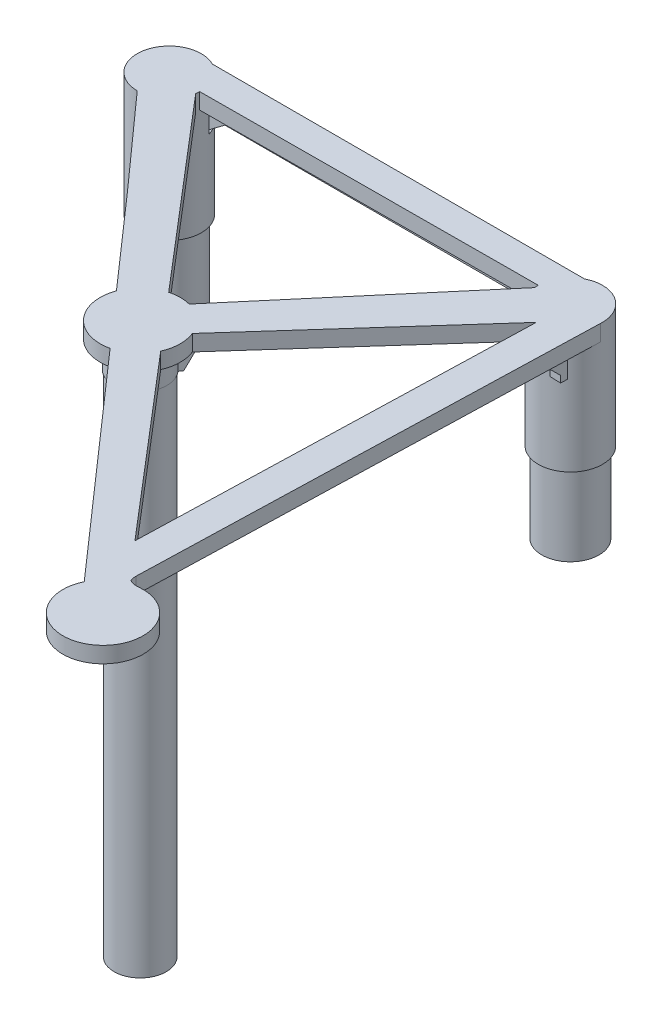
from build123d import *
from build123d.topology import SkipClean

# Parameters (mm, degrees)
EXTRUDE_1_DEPTH     = 3
SKETCH_2_R          = 5.35
EXTRUDE_2_DEPTH     = 23
CUT_EXTRUDE_1_DEPTH = 3
SKETCH_4_R          = 5
EXTRUDE_3_DEPTH     = 100
EXTRUDE_START       = 3
SKETCH_5_R          = 5
EXTRUDE_4_DEPTH     = 3
SKETCH_6_R          = 5.35
EXTRUDE_5_DEPTH     = 5
SKETCH_7_R          = 5.35
EXTRUDE_6_DEPTH     = 5
SKETCH_8_W          = 75
SKETCH_8_H          = 10.7
EXTRUDE_7_DEPTH     = 3
EXTRUDE_8_DEPTH     = 3
CUT_EXTRUDE_2_DEPTH = 3
SKETCH_12_R         = 6
EXTRUDE_10_DEPTH    = 13
SKETCH_13_R         = 3
CUT_EXTRUDE_3_DEPTH = 23
SKETCH_14_R         = 3.125
CUT_EXTRUDE_5_DEPTH = 100
SKETCH_15_R         = 6
SKETCH_15_R_2       = 5.35
EXTRUDE_11_DEPTH    = 5
SKETCH_16_R         = 6
SKETCH_16_R_2       = 3
EXTRUDE_12_DEPTH    = 5
SKETCH_17_R         = 5.35
SKETCH_17_R_2       = 3
EXTRUDE_13_DEPTH    = 5
SKETCH_18_R         = 5.35
SKETCH_18_R_2       = 3
EXTRUDE_14_DEPTH    = 5
SKETCH_20_R         = 6
SKETCH_20_R_2       = 5.35
EXTRUDE_15_DEPTH    = 5
SKETCH_21_R         = 6
SKETCH_21_R_2       = 5.35
EXTRUDE_16_DEPTH    = 5
SKETCH_22_R         = 5.35
SKETCH_22_R_2       = 3
EXTRUDE_17_DEPTH    = 5
SKETCH_23_R         = 5.35
SKETCH_23_R_2       = 3
EXTRUDE_18_DEPTH    = 5
SKETCH_25_R         = 7.5
EXTRUDE_20_DEPTH    = 3
EXTRUDE_21_DEPTH    = 3
EXTRUDE_23_DEPTH    = 3
SKETCH_30_R         = 7.5
EXTRUDE_24_DEPTH    = 3
FILLET_1_R          = 3
EXTRUDE_29_DEPTH    = 5
EXTRUDE_31_DEPTH    = 2
SKETCH_50_R         = 5
EXTRUDE_32_DEPTH    = 103
CUT_EXTRUDE_START   = -95
SKETCH_51_R         = 5
SKETCH_51_R_2       = 4.875
CUT_EXTRUDE_6_DEPTH = 95
SKETCH_52_W         = 5.65685425
SKETCH_52_H         = 5.656854249
CUT_EXTRUDE_7_DEPTH = 100


with BuildPart() as part:
    # 草图1 → 凸台-拉伸1 (new body)
    with BuildSketch(Plane(origin=(0, 0, 0), x_dir=(1, 0, 0), z_dir=(0, 1, 0))):
        Polygon((-18.65535641, 0), (18.84464359, -42.930983399), (56.34464359, 0), align=None)
    extrude(amount=EXTRUDE_1_DEPTH)

    # 草图2 → 凸台-拉伸2 (add)
    with BuildSketch(Plane(origin=(0, 3, 0), x_dir=(1, 0, 0), z_dir=(0, 1, 0))):
        with Locations(Location((56.34464359, 0, 0), (0, 0, 270))):
            Circle(SKETCH_2_R)
        with Locations(Location((-18.65535641, 0, 0), (0, 0, 270))):
            Circle(SKETCH_2_R)
    extrude(amount=-EXTRUDE_2_DEPTH)

    # 草图3 → 切除-拉伸1 (cut)
    with BuildSketch(Plane.XZ):
        Polygon((8.632668758, 17.559374543), (1.15609776, 9), (33.75905687, 9), (36.53318942, 9), (29.056618422, 17.559374543), (18.84464359, 29.25031113), align=None)
    extrude(amount=-CUT_EXTRUDE_1_DEPTH, mode=Mode.SUBTRACT)

    # 草图4 → 凸台-拉伸3 (add)
    with BuildSketch(Plane.XZ):
        with Locations(Location((18.84464359, 42.930983399, 0), (0, 0, 228.862949093))):
            Circle(SKETCH_4_R)
    extrude(amount=EXTRUDE_3_DEPTH)

    # 草图5 → 凸台-拉伸4 (add)
    with BuildSketch(Plane(origin=(0, 0, 0), x_dir=(1, 0, 0), z_dir=(0, 1, 0)).offset(EXTRUDE_START)):
        with Locations(Location((18.84464359, -42.930983399, 0), (0, 0, 131.137050907))):
            Circle(SKETCH_5_R)
    extrude(amount=-EXTRUDE_4_DEPTH)

    # 草图6 → 凸台-拉伸5 (add)
    with SkipClean():  # the faces are left unmerged after this step: merging them gives an invalid solid
        with BuildSketch(Plane.XZ.offset(20)):
            with Locations(Location((56.34464359, 0, 0), (0, 0, 131.137050907))):
                Circle(SKETCH_6_R)
        extrude(amount=EXTRUDE_5_DEPTH)
    add(part.part.scale(1), mode=Mode.REPLACE)  # the faces are merged on a copy

    # 草图7 → 凸台-拉伸6 (add)
    with BuildSketch(Plane.XZ.offset(20)):
        with Locations(Location((-18.65535641, 0, 0), (0, 0, 48.862949093))):
            Circle(SKETCH_7_R)
    extrude(amount=EXTRUDE_6_DEPTH)

    # 草图8 → 凸台-拉伸7 (add)
    with SkipClean():  # the faces are left unmerged after this step: merging them gives an invalid solid
        with BuildSketch(Plane(origin=(0, 3, 0), x_dir=(1, 0, 0), z_dir=(0, 1, 0))):
            with Locations((18.84464359, 0)):
                Rectangle(SKETCH_8_W, SKETCH_8_H)
        extrude(amount=-EXTRUDE_7_DEPTH)

    # 草图9 → 凸台-拉伸8 (add)
    with SkipClean():  # the faces are left unmerged after this step: merging them gives an invalid solid
        with BuildSketch(Plane(origin=(0, 3, 0), x_dir=(1, 0, 0), z_dir=(0, 1, 0))):
            Polygon((61.69464359, 0), (18.84464359, -47.930983399), (-24.00535641, 0), align=None)
        extrude(amount=-EXTRUDE_8_DEPTH)

    # 草图10 → 切除-拉伸2 (cut)
    with SkipClean():  # the faces are left unmerged after this step: merging them gives an invalid solid
        with BuildSketch(Plane.XZ):
            Polygon((18.84464359, 37.930983399), (-13.313716495, 0.298969924), (50.99464359, 0), align=None)
        extrude(amount=-CUT_EXTRUDE_2_DEPTH, mode=Mode.SUBTRACT)

    # 草图12 → 凸台-拉伸10 (add)
    with SkipClean():  # the faces are left unmerged after this step: merging them gives an invalid solid
        with BuildSketch(Plane(origin=(0, 3, 0), x_dir=(1, 0, 0), z_dir=(0, 1, 0))):
            with Locations(Location((-18.65535641, 0, 0), (0, 0, 270))):
                Circle(SKETCH_12_R)
            with Locations(Location((56.34464359, 0, 0), (0, 0, 270))):
                Circle(SKETCH_12_R)
        extrude(amount=-EXTRUDE_10_DEPTH)

    # 草图13 → 切除-拉伸3 (cut)
    with SkipClean():  # the faces are left unmerged after this step: merging them gives an invalid solid
        with BuildSketch(Plane.XZ.offset(25)):
            with Locations(Location((-18.65535641, 0, 0), (0, 0, 270))):
                Circle(SKETCH_13_R)
            with Locations(Location((56.34464359, 0, 0), (0, 0, 270))):
                Circle(SKETCH_13_R)
        extrude(amount=-CUT_EXTRUDE_3_DEPTH, mode=Mode.SUBTRACT)

    # 草图14 → 切除-拉伸5 (cut)
    with SkipClean():  # the faces are left unmerged after this step: merging them gives an invalid solid
        with BuildSketch(Plane.XZ.offset(100)):
            with Locations(Location((18.84464359, 42.930983399, 0), (0, 0, 270))):
                Circle(SKETCH_14_R)
        extrude(amount=-CUT_EXTRUDE_5_DEPTH, mode=Mode.SUBTRACT)

    # 草图15 → 凸台-拉伸11 (add)
    with SkipClean():  # the faces are left unmerged after this step: merging them gives an invalid solid
        with BuildSketch(Plane.XZ.offset(10)):
            with Locations(Location((56.34464359, 0, 0), (0, 0, 90.133194259))):
                Circle(SKETCH_15_R)
            with Locations(Location((56.34464359, 0, 0), (0, 0, 270))):
                Circle(SKETCH_15_R_2, mode=Mode.SUBTRACT)
        extrude(amount=EXTRUDE_11_DEPTH)

    # 草图16 → 凸台-拉伸12 (add)
    with SkipClean():  # the faces are left unmerged after this step: merging them gives an invalid solid
        with BuildSketch(Plane.XZ.offset(10)):
            with Locations(Location((-18.65535641, 0, 0), (0, 0, 89.866805741))):
                Circle(SKETCH_16_R)
            with Locations(Location((-18.65535641, 0, 0), (0, 0, 270))):
                Circle(SKETCH_16_R_2, mode=Mode.SUBTRACT)
        extrude(amount=EXTRUDE_12_DEPTH)

    # 草图17 → 凸台-拉伸13 (add)
    with SkipClean():  # the faces are left unmerged after this step: merging them gives an invalid solid
        with BuildSketch(Plane.XZ.offset(25)):
            with Locations(Location((-18.65535641, 0, 0), (0, 0, 270))):
                Circle(SKETCH_17_R)
            with Locations(Location((-18.65535641, 0, 0), (0, 0, 270))):
                Circle(SKETCH_17_R_2, mode=Mode.SUBTRACT)
        extrude(amount=EXTRUDE_13_DEPTH)

    # 草图18 → 凸台-拉伸14 (add)
    with SkipClean():  # the faces are left unmerged after this step: merging them gives an invalid solid
        with BuildSketch(Plane.XZ.offset(25)):
            with Locations(Location((56.34464359, 0, 0), (0, 0, 270))):
                Circle(SKETCH_18_R)
            with Locations(Location((56.34464359, 0, 0), (0, 0, 270))):
                Circle(SKETCH_18_R_2, mode=Mode.SUBTRACT)
        extrude(amount=EXTRUDE_14_DEPTH)

    # 草图20 → 凸台-拉伸15 (add)
    with SkipClean():  # the faces are left unmerged after this step: merging them gives an invalid solid
        with BuildSketch(Plane.XZ.offset(15)):
            with Locations(Location((-18.65535641, 0, 0), (0, 0, 89.866805741))):
                Circle(SKETCH_20_R)
            with Locations(Location((-18.65535641, 0, 0), (0, 0, 270))):
                Circle(SKETCH_20_R_2, mode=Mode.SUBTRACT)
        extrude(amount=EXTRUDE_15_DEPTH)

    # 草图21 → 凸台-拉伸16 (add)
    with SkipClean():  # the faces are left unmerged after this step: merging them gives an invalid solid
        with BuildSketch(Plane.XZ.offset(15)):
            with Locations(Location((56.34464359, 0, 0), (0, 0, 90.133194259))):
                Circle(SKETCH_21_R)
            with Locations(Location((56.34464359, 0, 0), (0, 0, 270))):
                Circle(SKETCH_21_R_2, mode=Mode.SUBTRACT)
        extrude(amount=EXTRUDE_16_DEPTH)

    # 草图22 → 凸台-拉伸17 (add)
    with SkipClean():  # the faces are left unmerged after this step: merging them gives an invalid solid
        with BuildSketch(Plane.XZ.offset(30)):
            with Locations(Location((-18.65535641, 0, 0), (0, 0, 270))):
                Circle(SKETCH_22_R)
            with Locations(Location((-18.65535641, 0, 0), (0, 0, 270))):
                Circle(SKETCH_22_R_2, mode=Mode.SUBTRACT)
        extrude(amount=EXTRUDE_17_DEPTH)

    # 草图23 → 凸台-拉伸18 (add)
    with SkipClean():  # the faces are left unmerged after this step: merging them gives an invalid solid
        with BuildSketch(Plane.XZ.offset(30)):
            with Locations(Location((56.34464359, 0, 0), (0, 0, 270))):
                Circle(SKETCH_23_R)
            with Locations(Location((56.34464359, 0, 0), (0, 0, 270))):
                Circle(SKETCH_23_R_2, mode=Mode.SUBTRACT)
        extrude(amount=EXTRUDE_18_DEPTH)

    # 草图25 → 凸台-拉伸20 (add)
    with SkipClean():  # the faces are left unmerged after this step: merging them gives an invalid solid
        with BuildSketch(Plane(origin=(0, 3, 0), x_dir=(1, 0, 0), z_dir=(0, 1, 0))):
            with Locations((18.84464359, -42.930983399)):
                Circle(SKETCH_25_R)
        extrude(amount=-EXTRUDE_20_DEPTH)

    # 草图28 → 凸台-拉伸21 (add)
    with SkipClean():  # the faces are left unmerged after this step: merging them gives an invalid solid
        with BuildSketch(Plane(origin=(0, 3, 0), x_dir=(1, 0, 0), z_dir=(0, 1, 0))):
            Polygon((-3.379636645, -23.071435978), (2.093554995, -18.328702995), (68.652557408, -96.216669577), (66.868599364, -97.910067347), (64.321605904, -100.026810209), align=None)
        extrude(amount=-EXTRUDE_21_DEPTH)

    # 草图29 → 凸台-拉伸23 (add)
    with SkipClean():  # the faces are left unmerged after this step: merging them gives an invalid solid
        with BuildSketch(Plane(origin=(0, 3, 0), x_dir=(1, 0, 0), z_dir=(0, 1, 0))):
            Polygon((56.34464359, 0), (53.74105837, -88), (59.74105837, -88), (62.34464359, 0), align=None)
        extrude(amount=-EXTRUDE_23_DEPTH)

    # 草图30 → 凸台-拉伸24 (add)
    with SkipClean():  # the faces are left unmerged after this step: merging them gives an invalid solid
        with BuildSketch(Plane(origin=(0, 3, 0), x_dir=(1, 0, 0), z_dir=(0, 1, 0))):
            with Locations((62.6531538, -93.694621783)):
                Circle(SKETCH_30_R)
        extrude(amount=-EXTRUDE_24_DEPTH)

    # 圆角1
    # the kernel refuses this fillet: 3 mm, written as the material it adds along each edge
    with BuildSketch(Plane(origin=(60.387632696, 0, 86.544977448), x_dir=(-0.6496534253779116, 0, -0.760230509052844), z_dir=(0, 1, 0))) as fillet_1_piece_1:
        with BuildLine():
            CenterArc((1.763131122, -3), FILLET_1_R, 90, 55.663998218)
            ThreePointArc((-0.714100998, -1.307864951), (-0.324488751, -0.671711358), (0, 0))
            Line((0, 0), (1.763131122, 0))
        make_face()
    extrude(amount=3)
    with BuildSketch(Plane(origin=(59.804303017, 0, 85.862359607), x_dir=(0.02957325513951661, 0, -0.9995626156376863), z_dir=(0, 1, 0))) as fillet_1_piece_2:
        with BuildLine():
            CenterArc((FILLET_1_R * 0.38596961824, -FILLET_1_R), FILLET_1_R, 90, 42.210146514)
            Line((-FILLET_1_R * 0.285882149698, -FILLET_1_R * 0.259314370385), (0, 0))
            Line((0, 0), (FILLET_1_R * 0.38596961824, 0))
        make_face()
    extrude(amount=3)

    # 草图31 → 凸台-拉伸29 (add)
    with BuildSketch(Plane.XZ):
        Polygon((-14.723586471, -1.628179316), (-14.723586471, -3.628179316), (53.527409972, -3.628179316), (53.82491501, -1.628179316), align=None)
        Polygon((49.609847968, 80.102545011), (51.130308987, 78.80323816), (22.318773999, 45.087710689), (20.798312981, 46.38701754), align=None)
        Polygon((-15.349607435, 4.086383285), (-13.829146417, 2.787076434), (17.097273349, 38.977461836), (15.576812331, 40.276768687), align=None)
        Polygon((20.325894576, 39.186783249), (51.86894969, 1.971881231), (53.394639731, 3.265043982), (21.851584617, 40.479945999), align=None)
        Polygon((56.093860655, 78.864293565), (58.318881117, 3.659610745), (60.319756269, 3.659610745), (58.092985887, 78.923440075), align=None)
    extrude(amount=EXTRUDE_29_DEPTH)

    # 切除-扫描1: sweep along a path in 草图36
    with BuildLine(Plane.XZ.offset(5)) as sweep_1_path:
        Line((18.84464359, -3.628179316), (18.84464359, -1.628179316))
    # 草图35 → 切除-扫描1 (sweep, cut)
    with BuildSketch(Plane(origin=(0, 0, -3.628179316), x_dir=(-1, 0, 0), z_dir=(0, 0, -1))):
        Polygon((13.876620714, -5), (9.876620714, -2), (-47.565907894, -2), (-51.565907894, -5), align=None)
    sweep(path=sweep_1_path.line, mode=Mode.SUBTRACT)

    # 切除-扫描3: sweep along a path in 草图38
    with BuildLine(Plane.XZ.offset(5)) as sweep_3_path:
        Line((59.19369399, 41.720005215), (57.192818839, 41.720005215))
    # 草图37 → 切除-扫描3 (sweep, cut)
    with BuildSketch(Plane(origin=(60.375181238, 0, 1.786271926), x_dir=(0.029573255139513054, 0, -0.9995626156376864), z_dir=(0.9995626156376866, 0, 0.029573255139513057))):
        Polygon((-2.73149314, -5), (-6.73149314, -1), (-73.170921503, -1), (-77.170921503, -5), align=None)
    sweep(path=sweep_3_path.line, mode=Mode.SUBTRACT)

    # 草图39 → 凸台-拉伸31 (add)
    with BuildSketch(Plane(origin=(58.376056006, 0, 1.727125416), x_dir=(0.02957325513951297, 0, -0.9995626156376864), z_dir=(0.9995626156376866, 0, 0.029573255139512974))):
        Polygon((-3.961044, -3.829621531), (-3.961044, -5), (-2.73149314, -5), (-2.73149314, -4.501704435), (-3.961044, -3.272153575), align=None)
    extrude(amount=EXTRUDE_31_DEPTH)

    # 切除-扫描5: sweep along a path in 草图42
    with BuildLine(Plane.XZ.offset(5)) as sweep_5_path:
        Line((0.095091388, 22.159914171), (1.552120507, 20.786378718))
    # 草图40 → 切除-扫描5 (sweep, cut)
    with BuildSketch(Plane(origin=(-10.889521113, 0, 9.305617977), x_dir=(0.6496534253779145, 0, 0.7602305090528415), z_dir=(-0.7602305090528415, 0, 0.6496534253779145))):
        Polygon((-5.121187346, -5), (-3.121187346, -1), (36.9380259, -1), (38.9380259, -5), align=None)
    sweep(path=sweep_5_path.line, mode=Mode.SUBTRACT)

    # 切除-扫描6: sweep along a path in 草图44
    with BuildLine(Plane.XZ.offset(5)) as sweep_6_path:
        Line((36.035656698, 20.652203895), (37.472857905, 22.049766909))
    # 草图43 → 切除-扫描6 (sweep, cut)
    with BuildSketch(Plane(origin=(31.1568423, 0, 26.408291855), x_dir=(-0.6465813751887421, 0, 0.7628450204720715), z_dir=(-0.7628450204720715, 0, -0.6465813751887421))):
        Polygon((14.734624595, -5), (12.734624595, -1), (-27.825731715, -1), (-29.825731715, -5), align=None)
    sweep(path=sweep_6_path.line, mode=Mode.SUBTRACT)

    # 切除-扫描7: sweep along a path in 草图47
    with BuildLine(Plane.XZ.offset(5)) as sweep_7_path:
        Line((37.03221924, 62.305521799), (35.511758222, 63.60482865))
    # 草图46 → 切除-扫描7 (sweep, cut)
    with BuildSketch(Plane(origin=(-10.889521113, 0, 9.305617977), x_dir=(0.6496534253779142, 0, 0.7602305090528417), z_dir=(-0.7602305090528417, 0, 0.6496534253779142))):
        Polygon((50.821835343, -5), (52.821835343, -1), (88.125606235, -1), (93.125606235, 0), (93.125606235, -5), align=None)
    sweep(path=sweep_7_path.line, mode=Mode.SUBTRACT)

    # 切除-扫描8: sweep along a path in 草图49
    with BuildLine(Plane.XZ.offset(1)) as sweep_8_path:
        Line((58.211278907, 74.925189613), (56.210403756, 74.925189613))
        Line((56.210403756, 74.925189613), (55.379994456, 74.925189613))
    # 草图48 → 切除-扫描8 (sweep, cut)
    with BuildSketch(Plane(origin=(60.375181238, 0, 1.786271926), x_dir=(0.029573255139513054, 0, -0.9995626156376864), z_dir=(0.9995626156376866, 0, 0.029573255139513057))):
        Polygon((-73.170921503, -1), (-77.170921503, 0), (-77.170921503, -5), align=None)
    sweep(path=sweep_8_path.line, mode=Mode.SUBTRACT)

    # 草图50 → 凸台-拉伸32 (add)
    with BuildSketch(Plane(origin=(0, 3, 0), x_dir=(1, 0, 0), z_dir=(0, 1, 0))):
        with Locations(Location((18.84464359, -42.930983399, 0), (0, 0, 301.772799352))):
            Circle(SKETCH_50_R)
    extrude(amount=-EXTRUDE_32_DEPTH)

    # 草图51 → 切除-拉伸6 (cut)
    with BuildSketch(Plane.XZ.offset(100).offset(CUT_EXTRUDE_START)):
        with Locations((18.84464359, 42.930983399)):
            Circle(SKETCH_51_R)
        with Locations(Location((18.84464359, 42.930983399, 0), (0, 0, 270))):
            Circle(SKETCH_51_R_2, mode=Mode.SUBTRACT)
    extrude(amount=CUT_EXTRUDE_6_DEPTH, mode=Mode.SUBTRACT)

    # 草图52 → 切除-拉伸7 (cut)
    with BuildSketch(Plane.XZ.offset(100)):
        with Locations((18.84464359, 42.930983399)):
            Rectangle(SKETCH_52_W, SKETCH_52_H)
    extrude(amount=-CUT_EXTRUDE_7_DEPTH, mode=Mode.SUBTRACT)


solid = part.part
